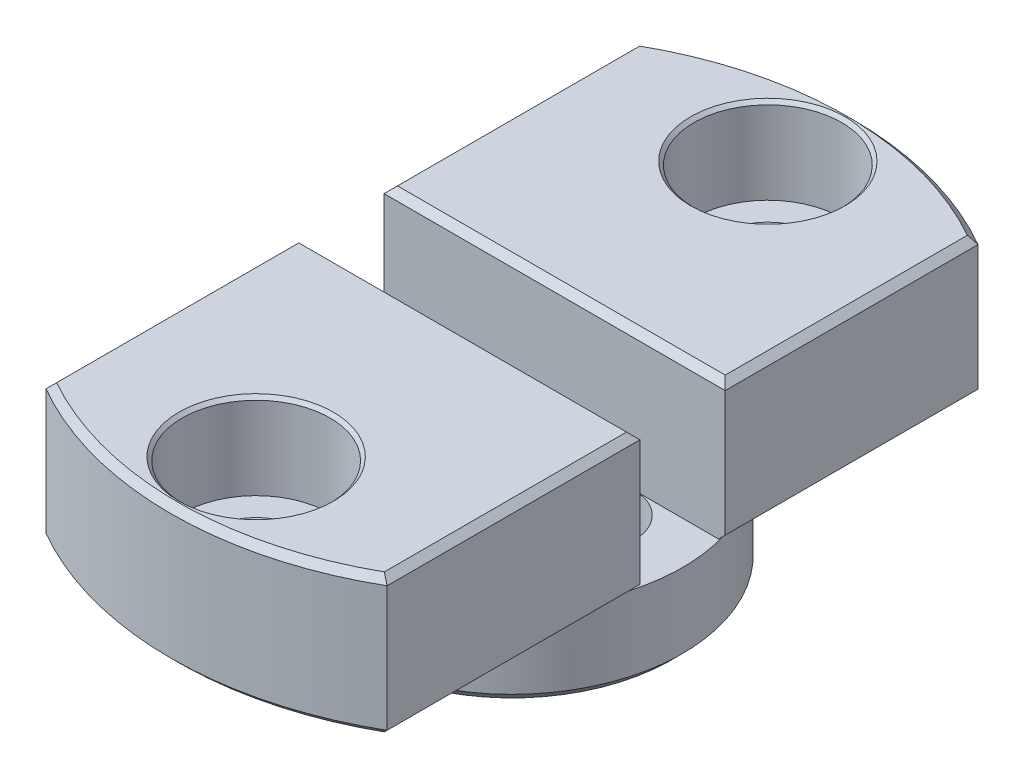
from build123d import *

# Parameters (mm, degrees)
BOSS_EXTRUDE1_DEPTH                          = 10.32
SKETCH2_R                                    = 12.7
BOSS_EXTRUDE2_DEPTH                          = 6.35
CUT_EXTRUDE3_DEPTH                           = 33.929301541
CUT_EXTRUDE3_DEPTH_BACK                      = 33.929301541
SKETCH9_R                                    = 1.2
CUT_EXTRUDE4_DEPTH                           = 3.175
CBORE_FOR_M6_HEX_SOCKET_HEAD_CAP_SCR_2_COUNT = 2
CBORE_FOR_M6_HEX_SOCKET_HEAD_CAP_SCR_2_PITCH = 38.1
FILLET2_R                                    = 3.175
FILLET3_R                                    = 3.175
CHAMFER2_SIZE                                = 0.8
CHAMFER3_SIZE                                = 0.5


# Some blends are built 0.0001 mm under size
with BuildPart() as part:
    # Sketch1 → Boss-Extrude1 (new body)
    with BuildSketch(Plane(origin=(0, 0, 0), x_dir=(1, 0, 0), z_dir=(0, 1, 0))):
        with BuildLine():
            Line((-12.7, 21.997045256), (-12.7, -21.997045256))
            ThreePointArc((-12.7, -21.997045256), (0, -25.4), (12.7, -21.997045256))
            Line((12.7, -21.997045256), (12.7, 21.997045256))
            ThreePointArc((12.7, 21.997045256), (0, 25.4), (-12.7, 21.997045256))
        make_face()
    extrude(amount=-BOSS_EXTRUDE1_DEPTH)

    # Sketch2 → Boss-Extrude2 (add)
    with BuildSketch(Plane.XZ.offset(10.32)):
        with Locations(Location((0, 0, 0), (0, 0, 180))):
            Circle(SKETCH2_R)
    extrude(amount=BOSS_EXTRUDE2_DEPTH)

    # Sketch9 → Cut-Extrude3 (cut, two sides: drawn at the far end of the back side and taken through both)
    with BuildSketch(Plane.XY.offset(-CUT_EXTRUDE3_DEPTH_BACK)):
        with Locations((1.2, -13.495)):
            Circle(SKETCH9_R)
    extrude(amount=CUT_EXTRUDE3_DEPTH + CUT_EXTRUDE3_DEPTH_BACK, mode=Mode.SUBTRACT)

    # Sketch10 → Cut-Extrude4 (cut, symmetric)
    with BuildSketch(Plane.XY):
        Polygon((9.128125, -16.67), (9.128125, -10.32), (12.7, -10.32), (12.7, 0), (-12.7, 0), (-12.7, -10.32), (-10.326252745, -10.32), (-6.202514528, -16.67), align=None)
    extrude(amount=CUT_EXTRUDE4_DEPTH, both=True, mode=Mode.SUBTRACT)

    # Sketch13 → CBORE for M6 Hex Socket Head Cap Screw2 (revolve, cut)
    with BuildSketch(Plane(origin=(0, 0, -19.05), x_dir=(0, 0, 1), z_dir=(1, 0, 0))):
        Polygon((0, 0), (0, 10.32), (3.5, 10.32), (3.3, 10.12), (3.3, 6.6), (3.5, 6.4), (5.5, 6.4), (5.5, 0.25), (5.75, 0), align=None)
    cbore_for_m6_hex_socket_head_cap_screw2 = revolve(axis=Axis((0, 6.35, -19.05), (0, -1, 0)), mode=Mode.SUBTRACT)

    # CBORE for M6 Hex Socket Head Cap Scr 2: CBORE for M6 Hex Socket Head Cap Screw2 ×2
    with Locations(*[(0, 0, i * CBORE_FOR_M6_HEX_SOCKET_HEAD_CAP_SCR_2_PITCH) for i in range(1, CBORE_FOR_M6_HEX_SOCKET_HEAD_CAP_SCR_2_COUNT)]):
        add(cbore_for_m6_hex_socket_head_cap_screw2, mode=Mode.SUBTRACT)

    # Fillet2
    fillet2_edges = [part.edges().sort_by_distance(p)[0] for p in [
        (9.128125, -13.495, 3.175),
        (9.128125, -13.495, -3.175),
    ]]
    fillet(fillet2_edges, radius=FILLET2_R - 0.0001)  # a hair under: the kernel refuses the full size

    # Fillet3
    fillet3_edges = [part.edges().sort_by_distance(p)[0] for p in [
        (-8.264383637, -13.495, 3.175),
        (-8.264383637, -13.495, -3.175),
    ]]
    fillet(fillet3_edges, radius=FILLET3_R - 0.0001)  # a hair under: the kernel refuses the full size

    # Sketch14 → Cut-Revolve5 (revolve, cut)
    with BuildSketch(Plane.XY, mode=Mode.PRIVATE) as cut_revolve5_sk:
        Polygon((-2.984654144, -12.444678171), (-7.981398467, -15.689601875), (-10.497950031, -14.462197667), (-4.291787828, -10.431868808), align=None)
    revolve(cut_revolve5_sk.sketch.rotate(Axis((-8.485140668, -13.155063983, 0), (-0.8386705679454227, -0.5446390350150291, 0)), 180), axis=Axis((-8.485140668, -13.155063983, 0), (-0.8386705679454227, -0.5446390350150291, 0)), mode=Mode.SUBTRACT)

    # Chamfer2
    chamfer2_edges = [part.edges().sort_by_distance(p)[0] for p in [
        (12.7, -16.67, 0),
    ]]
    chamfer(chamfer2_edges, length=CHAMFER2_SIZE)

    # Chamfer3
    # the kernel refuses this chamfer: 0.5 mm, written as the material it takes off along each edge
    with BuildSketch(Plane(origin=(0, -10.32, 0), x_dir=(-0.5431897052031074, 0, 0.839609995272425), z_dir=(-0.839609995272425, 0, -0.5431897052031074))) as chamfer3_piece_1:
        Polygon((25.4 - CHAMFER3_SIZE, 0), (25.4, CHAMFER3_SIZE), (25.4, 0), align=None)
    revolve(axis=Axis((0, -10.32, 0), (0, 1, 0)), revolution_arc=65.802082053, mode=Mode.SUBTRACT)
    with BuildSketch(Plane(origin=(12.7, -10.32, 23.28288675), x_dir=(-0.9996219169112968, -0.027495876610585647, 0), z_dir=(0, 0, -1)), Plane(origin=(12.7, 0, -1.889158506), x_dir=(0.02749587661058563, -0.9996219169112968, 0), z_dir=(0, 0, -1)), Plane(origin=(12.7, -10.32, -1.889158506), x_dir=(-0.9996219169112968, -0.027495876610585647, 0), z_dir=(0, 0, -1)), Plane(origin=(-12.7, -10.32, 1.889158506), x_dir=(0.9996219169112968, -0.027495876610585647, 0), z_dir=(0, 0, 1)), Plane(origin=(12.7, 0, 23.28288675), x_dir=(0.02749587661058563, -0.9996219169112968, 0), z_dir=(0, 0, -1)), Plane(origin=(-12.7, -10.32, -23.28288675), x_dir=(0.9996219169112968, -0.027495876610585647, 0), z_dir=(0, 0, 1))) as chamfer3_piece_2:
        Polygon((CHAMFER3_SIZE * 0.999621916911, CHAMFER3_SIZE * 0.0274958766106), (-CHAMFER3_SIZE * 0.0274958766106, CHAMFER3_SIZE * 0.999621916911), (0, 0), align=None)
    extrude(amount=21.393728244, mode=Mode.SUBTRACT)
    with BuildSketch(Plane(origin=(-12.7, 0, 1.889158506), x_dir=(0.9996219169112968, 0.02749587661058639, 0), z_dir=(0, 0, 1)), Plane(origin=(-12.7, 0, -23.28288675), x_dir=(0.9996219169112968, 0.02749587661058639, 0), z_dir=(0, 0, 1))) as chamfer3_piece_3:
        Polygon((CHAMFER3_SIZE * 0.999621916911, -CHAMFER3_SIZE * 0.0274958766106), (-CHAMFER3_SIZE * 0.0274958766106, -CHAMFER3_SIZE * 0.999621916911), (0, 0), align=None)
    extrude(amount=21.393728244, mode=Mode.SUBTRACT)
    with BuildSketch(Plane(origin=(13.985841494, 0, 3.175), x_dir=(0, -0.9996219169112968, -0.027495876610586494), z_dir=(-1, 0, 0))) as chamfer3_piece_4:
        Polygon((CHAMFER3_SIZE * 0.999621916911, CHAMFER3_SIZE * 0.0274958766106), (-CHAMFER3_SIZE * 0.0274958766106, CHAMFER3_SIZE * 0.999621916911), (0, 0), align=None)
    extrude(amount=27.971682988, mode=Mode.SUBTRACT)
    with BuildSketch(Plane(origin=(13.985841494, 0, -3.175), x_dir=(0, -0.9996219169112968, 0.027495876610586494), z_dir=(-1, 0, 0))) as chamfer3_piece_5:
        Polygon((CHAMFER3_SIZE * 0.999621916911, -CHAMFER3_SIZE * 0.0274958766106), (-CHAMFER3_SIZE * 0.0274958766106, -CHAMFER3_SIZE * 0.999621916911), (0, 0), align=None)
    extrude(amount=27.971682988, mode=Mode.SUBTRACT)
    with BuildSketch(Plane(origin=(0, -10.32, 0), x_dir=(0.5431897052031078, 0, -0.8396099952724246), z_dir=(0.8396099952724246, 0, 0.5431897052031078))) as chamfer3_piece_6:
        Polygon((25.4 - CHAMFER3_SIZE, 0), (25.4, CHAMFER3_SIZE), (25.4, 0), align=None)
    revolve(axis=Axis((0, -10.32, 0), (0, 1, 0)), revolution_arc=65.802082053, mode=Mode.SUBTRACT)
    with BuildSketch(Plane(origin=(0, 0, 0), x_dir=(-0.5431897052031074, 0, 0.839609995272425), z_dir=(-0.839609995272425, 0, -0.5431897052031074))) as chamfer3_piece_7:
        Polygon((25.4 - CHAMFER3_SIZE, 0), (25.4, -CHAMFER3_SIZE), (25.4, 0), align=None)
    revolve(axis=Axis((0, 0, 0), (0, 1, 0)), revolution_arc=65.802082053, mode=Mode.SUBTRACT)
    with BuildSketch(Plane(origin=(0, 0, 0), x_dir=(0.5431897052031078, 0, -0.8396099952724246), z_dir=(0.8396099952724246, 0, 0.5431897052031078))) as chamfer3_piece_8:
        Polygon((25.4 - CHAMFER3_SIZE, 0), (25.4, -CHAMFER3_SIZE), (25.4, 0), align=None)
    revolve(axis=Axis((0, 0, 0), (0, 1, 0)), revolution_arc=65.802082053, mode=Mode.SUBTRACT)


solid = part.part
